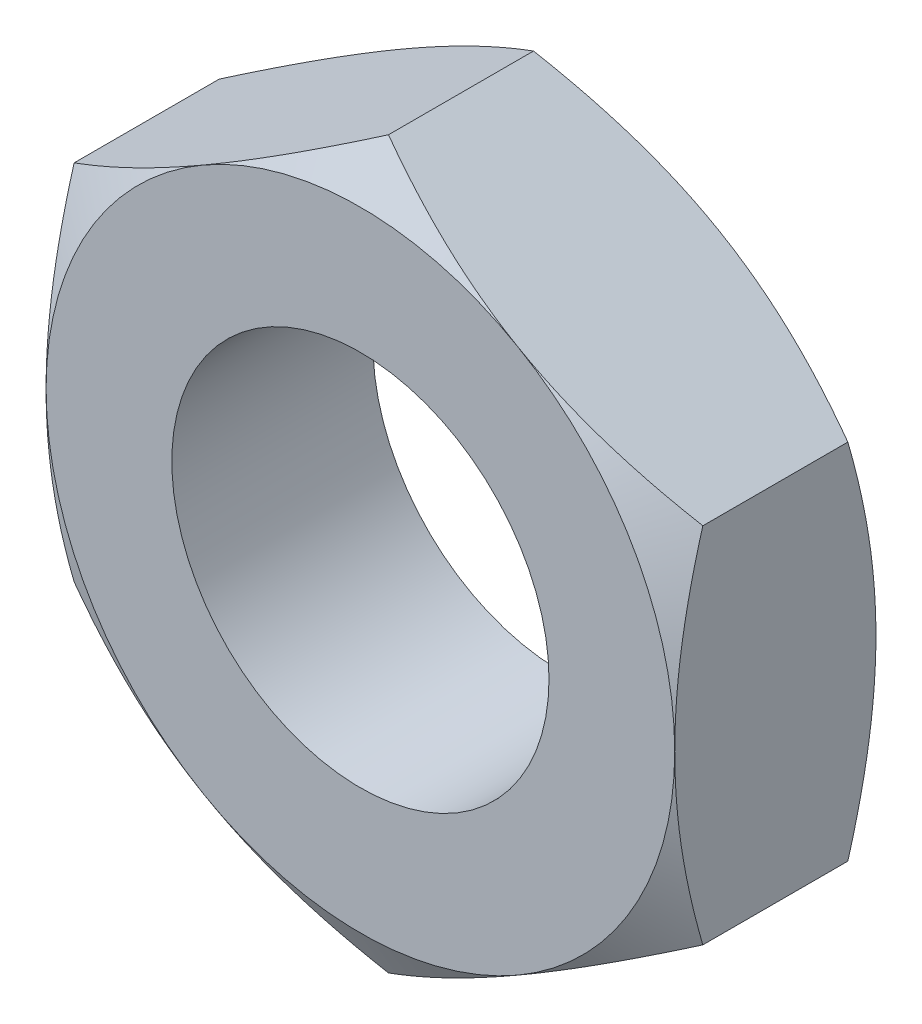
from build123d import *

# Parameters (mm, degrees)
BASE_EXTRUSION_DEPTH    = 3.2
ESQUISSE3_R             = 3
ENL_V_MAT_EXTRU_1_DEPTH = 9.280901722


with BuildPart() as part:
    # Esquisse1 → Base-Extrusion (new body)
    with BuildSketch(Plane.XY):
        Polygon((5, -2.886751346), (5, 2.886751346), (0, 5.773502692), (-5, 2.886751346), (-5, -2.886751346), (0, -5.773502692), align=None)
    extrude(amount=-BASE_EXTRUSION_DEPTH)

    # Esquisse2 → Enlèvement de matière-Révolution1 (revolve, cut)
    with BuildSketch(Plane(origin=(0, 0, 0), x_dir=(1, 0, 0), z_dir=(0, 1, 0))):
        Polygon((-5, 0), (-8.771281292, 0), (-8.771281292, 3.2), (-5, 3.2), (-7.771281292, 1.6), align=None)
    revolve(axis=Axis((0, 0, -3.2), (0, 0, 1)), mode=Mode.SUBTRACT)

    # Esquisse3 → Enlèv. mat.-Extru.1 (cut, through all)
    with BuildSketch(Plane.XY):
        Circle(ESQUISSE3_R)
    extrude(amount=-ENL_V_MAT_EXTRU_1_DEPTH, mode=Mode.SUBTRACT)


solid = part.part
